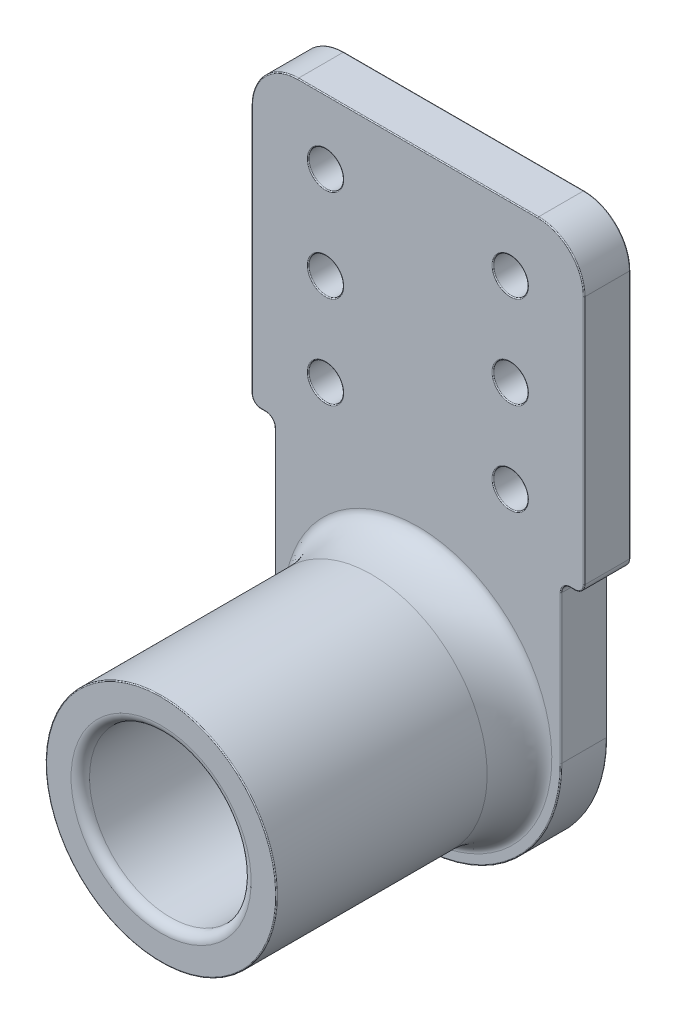
from build123d import *

# Parameters (mm, degrees)
SKETCH2_W               = 35.305846982
SKETCH2_H               = 15.875
BOSS_EXTRUDE1_DEPTH     = 6.35
CUT_EXTRUDE1_DEPTH      = 79.453545572
CUT_EXTRUDE1_DEPTH_BACK = 79.453545572
SKETCH5_R               = 11.1125
SKETCH7_W               = 3.175
SKETCH7_H               = 41.91
BOSS_EXTRUDE2_DEPTH     = 6.35
SKETCH8_R               = 2.38125
CUT_EXTRUDE2_DEPTH      = 80.309767291
FILLET1_SIZE            = 2.54
FILLET1_SIZE_2          = 6.35
FILLET2_R               = 1.27
FILLET3_R               = 6.35
FILLET4_R               = 1.27
FILLET5_R               = 0.127


with BuildPart() as part:
    # Sketch2 → Revolve1 (revolve)
    with BuildSketch(Plane(origin=(0, 0, 0), x_dir=(0, 0, -1), z_dir=(1, 0, 0)), mode=Mode.PRIVATE) as revolve1_sk:
        with Locations((535.050923491, -7.9375)):
            Rectangle(SKETCH2_W, SKETCH2_H)
    revolve(revolve1_sk.sketch.rotate(Axis((0, 0, -552.703846982), (0, 0, 1)), 180), axis=Axis((0, 0, -552.703846982), (0, 0, 1)))

    # Sketch4 → Boss-Extrude1 (add)
    with BuildSketch(Plane(origin=(0, 0, -552.703846982), x_dir=(-1, 0, 0), z_dir=(0, 0, -1))):
        with BuildLine():
            Line((-19.685, 0), (-19.685, 63.5))
            Line((-19.685, 63.5), (19.685, 63.5))
            Line((19.685, 63.5), (19.685, 0))
            ThreePointArc((19.685, 0), (0, -19.685), (-19.685, 0))
        make_face()
    extrude(amount=BOSS_EXTRUDE1_DEPTH)

    # Sketch5 → Cut-Extrude1 (cut, two sides: drawn at the far end of the back side and taken through both)
    with BuildSketch(Plane(origin=(0, 0, -559.053846982), x_dir=(-1, 0, 0), z_dir=(0, 0, -1)).offset(-CUT_EXTRUDE1_DEPTH_BACK)):
        with Locations(Location((0, 0, 0), (0, 0, 90))):
            Circle(SKETCH5_R)
    extrude(amount=CUT_EXTRUDE1_DEPTH + CUT_EXTRUDE1_DEPTH_BACK, mode=Mode.SUBTRACT)

    # Sketch7 → Boss-Extrude2 (add)
    with BuildSketch(Plane(origin=(0, 0, -559.053846982), x_dir=(-1, 0, 0), z_dir=(0, 0, -1))):
        with Locations((-21.2725, 42.545)):
            Rectangle(SKETCH7_W, SKETCH7_H)
        with Locations((21.2725, 42.545)):
            Rectangle(SKETCH7_W, SKETCH7_H)
    extrude(amount=-BOSS_EXTRUDE2_DEPTH)

    # Sketch8 → Cut-Extrude2 (cut, through all)
    with BuildSketch(Plane(origin=(0, 0, -559.053846982), x_dir=(-1, 0, 0), z_dir=(0, 0, -1))):
        with Locations(Location((12.7, 54.61, 0), (0, 0, 270))):
            Circle(SKETCH8_R)
        with Locations(Location((-12.7, 54.61, 0), (0, 0, 90))):
            Circle(SKETCH8_R)
        with Locations(Location((-12.7, 41.91, 0), (0, 0, 90))):
            Circle(SKETCH8_R)
        with Locations(Location((-12.7, 29.21, 0), (0, 0, 90))):
            Circle(SKETCH8_R)
        with Locations(Location((12.7, 41.91, 0), (0, 0, 270))):
            Circle(SKETCH8_R)
        with Locations(Location((12.7, 29.21, 0), (0, 0, 270))):
            Circle(SKETCH8_R)
    extrude(amount=-CUT_EXTRUDE2_DEPTH, mode=Mode.SUBTRACT)

    # Fillet1
    # an asymmetric fillet: 6.35, 2.54 mm, written as the material it adds along each edge
    with BuildSketch(Plane(origin=(0, 0, -552.703846982), x_dir=(0, 1, 0), z_dir=(1, 0, 0))) as fillet1_piece_1:
        with BuildLine():
            Bezier((15.875 + FILLET1_SIZE, 0), (15.875, 0), (15.875, FILLET1_SIZE_2), weights=[1, 0.707106781, 1])
            Line((15.875, FILLET1_SIZE_2), (15.875, 0))
            Line((15.875, 0), (15.875 + FILLET1_SIZE, 0))
        make_face()
    revolve(axis=Axis((0, 0, -552.703846982), (0, 0, 1)))

    # Fillet2
    fillet2_edges = [part.edges().sort_by_distance(p)[0] for p in [
        (22.86, 21.59, -555.878846982),
        (19.685, 21.59, -555.878846982),
        (-22.86, 21.59, -555.878846982),
        (-19.685, 21.59, -555.878846982),
    ]]
    fillet(fillet2_edges, radius=FILLET2_R)

    # Fillet3
    fillet3_edges = [part.edges().sort_by_distance(p)[0] for p in [
        (22.86, 63.5, -555.878846982),
        (-22.86, 63.5, -555.878846982),
    ]]
    fillet(fillet3_edges, radius=FILLET3_R)

    # Fillet4
    fillet4_edges = [part.edges().sort_by_distance(p)[0] for p in [
        (0, -11.1125, -517.398),
        (0, -11.1125, -559.053846982),
    ]]
    fillet(fillet4_edges, radius=FILLET4_R)

    # Fillet5
    fillet5_edges = [part.edges().sort_by_distance(p)[0] for p in [
        (-19.685, 10.16, -552.703846982),
        (20.056974388, 21.218025612, -552.703846982),
        (0, -19.685, -559.053846982),
        (-19.685, 10.16, -559.053846982),
        (0, 63.5, -552.703846982),
        (0, 63.5, -559.053846982),
        (22.86, 40.005, -559.053846982),
        (-21.000128061, 61.640128061, -559.053846982),
        (21.000128061, 61.640128061, -559.053846982),
        (22.86, 40.005, -552.703846982),
        (-21.000128061, 61.640128061, -552.703846982),
        (21.000128061, 61.640128061, -552.703846982),
        (0, -15.875, -517.398),
        (12.7, 39.52875, -552.703846982),
        (12.7, 39.52875, -559.053846982),
        (12.7, 26.82875, -552.703846982),
        (12.7, 26.82875, -559.053846982),
        (-12.7, 56.99125, -552.703846982),
        (-12.7, 56.99125, -559.053846982),
        (-12.7, 44.29125, -552.703846982),
        (-12.7, 44.29125, -559.053846982),
        (-12.7, 31.59125, -552.703846982),
        (-12.7, 31.59125, -559.053846982),
        (12.7, 52.22875, -552.703846982),
        (12.7, 52.22875, -559.053846982),
        (-21.2725, 21.59, -552.703846982),
        (-21.2725, 21.59, -559.053846982),
        (-22.86, 40.005, -559.053846982),
        (21.2725, 21.59, -559.053846982),
        (19.685, 10.16, -559.053846982),
        (22.488025612, 21.961974388, -559.053846982),
        (-22.488025612, 21.961974388, -559.053846982),
        (-22.86, 40.005, -552.703846982),
        (19.685, 10.16, -552.703846982),
        (21.2725, 21.59, -552.703846982),
        (22.488025612, 21.961974388, -552.703846982),
        (-22.488025612, 21.961974388, -552.703846982),
        (0, -19.685, -552.703846982),
        (-20.056974388, 21.218025612, -559.053846982),
        (-20.056974388, 21.218025612, -552.703846982),
        (20.056974388, 21.218025612, -559.053846982),
    ]]
    fillet(fillet5_edges, radius=FILLET5_R)


solid = part.part
